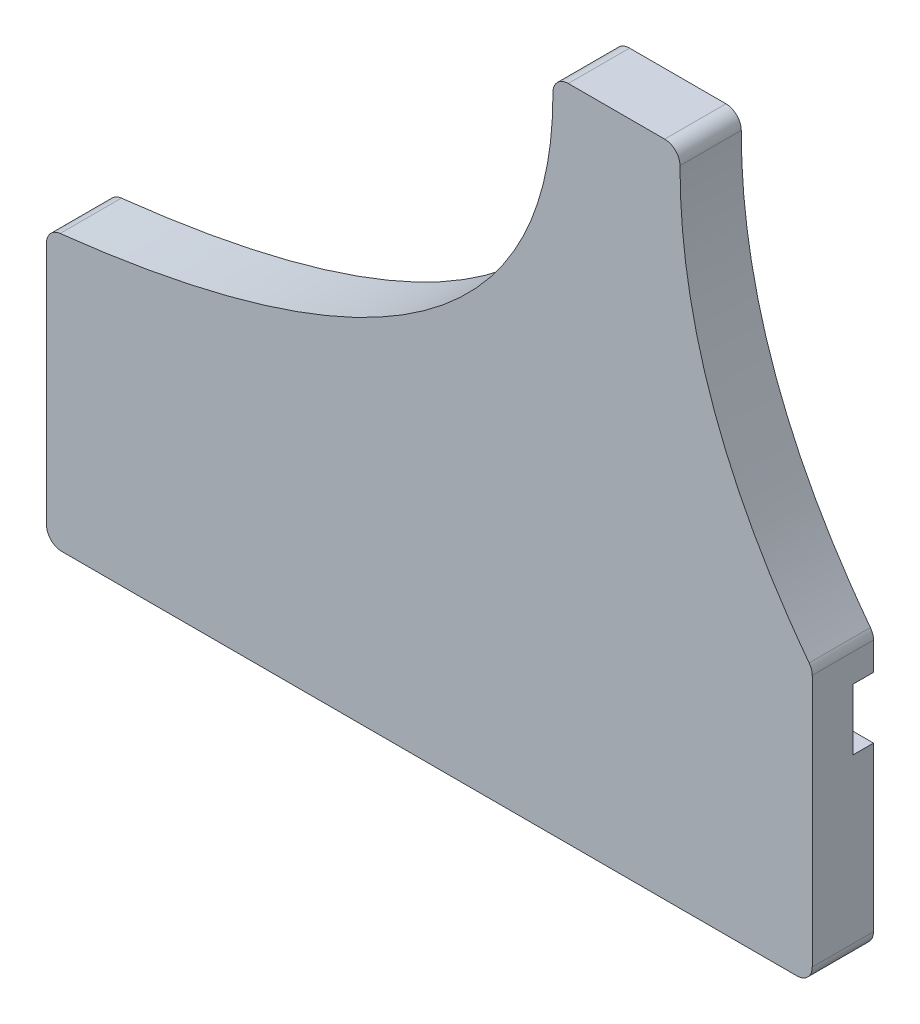
from build123d import *

# Parameters (mm, degrees)
AUFSATZ_LINEAR_AUSTRAGEN1_DEPTH = 12
SKIZZE1_4_W                     = 150
SKIZZE1_4_H                     = 12
SKIZZE1_4_W_2                   = 12
SKIZZE1_4_H_2                   = 55
SCHNITT_LINEAR_AUSTRAGEN2_DEPTH = 4
VERRUNDUNG1_R                   = 3


with BuildPart() as part:
    # Skizze1 → Aufsatz-Linear austragen1 (new body)
    with BuildSketch(Plane.XY):
        with BuildLine():
            Line((49.14, 88), (24.14, 88))
            add(Edge.make_bspline(
                [(24.14, 88), (26.807525043, 22.962561466), (-75, 12.5)],
                knots=[0, 0, 0, 1, 1, 1], degree=2))
            Line((-75, 12.5), (-75, -41))
            Line((-75, -41), (75, -41))
            Line((75, -41), (75, 12.5))
            add(Edge.make_bspline(
                [(49.14, 88), (47.999428855, 47.699903884), (75, 12.5)],
                knots=[0, 0, 0, 1, 1, 1], degree=2))
        make_face()
    extrude(amount=AUFSATZ_LINEAR_AUSTRAGEN1_DEPTH)

    # Skizze1<4> → Schnitt-Linear austragen2 (cut)
    with BuildSketch(Plane.XY):
        Rectangle(SKIZZE1_4_W, SKIZZE1_4_H)
        with Locations((36.64, 54)):
            Rectangle(SKIZZE1_4_W_2, SKIZZE1_4_H_2)
    extrude(amount=SCHNITT_LINEAR_AUSTRAGEN2_DEPTH, mode=Mode.SUBTRACT)

    # Verrundung1
    verrundung1_edges = [part.edges().sort_by_distance(p)[0] for p in [
        (75, -41, 6),
        (75, 12.5, 6),
        (49.14, 88, 6),
        (-75, -41, 6),
        (-75, 12.5, 6),
        (24.14, 88, 6),
    ]]
    fillet(verrundung1_edges, radius=VERRUNDUNG1_R)


solid = part.part
